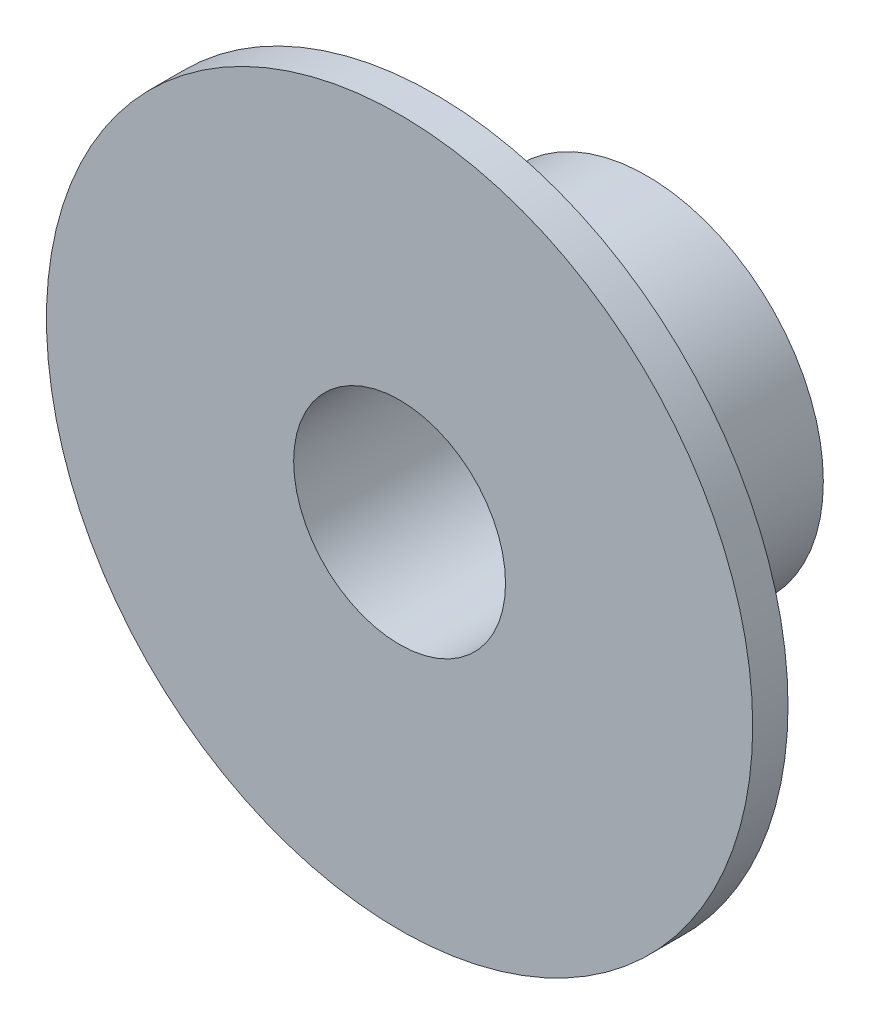
from build123d import *
from build123d.topology import SkipClean

# Parameters (mm, degrees)
SKETCH1_R           = 15.875
SKETCH1_R_2         = 4.7625
BOSS_EXTRUDE1_DEPTH = 1.5875
BOSS_EXTRUDE2_START = 9.525
SKETCH2_R           = 7.9375
SKETCH2_R_2         = 4.7625
BOSS_EXTRUDE2_DEPTH = 9.525


with BuildPart() as part:
    # Sketch1 → Boss-Extrude1 (new body)
    with BuildSketch(Plane.XY):
        Circle(SKETCH1_R)
        Circle(SKETCH1_R_2, mode=Mode.SUBTRACT)
    extrude(amount=BOSS_EXTRUDE1_DEPTH)

    # Sketch2 → Boss-Extrude2 (add)
    with SkipClean():  # the faces are left unmerged after this step: merging them gives an invalid solid
        with BuildSketch(Plane(origin=(0, 0, 0), x_dir=(-1, 0, 0), z_dir=(0, 0, -1)).offset(BOSS_EXTRUDE2_START)):
            Circle(SKETCH2_R)
            Circle(SKETCH2_R_2, mode=Mode.SUBTRACT)
        extrude(amount=-BOSS_EXTRUDE2_DEPTH)


solid = part.part
